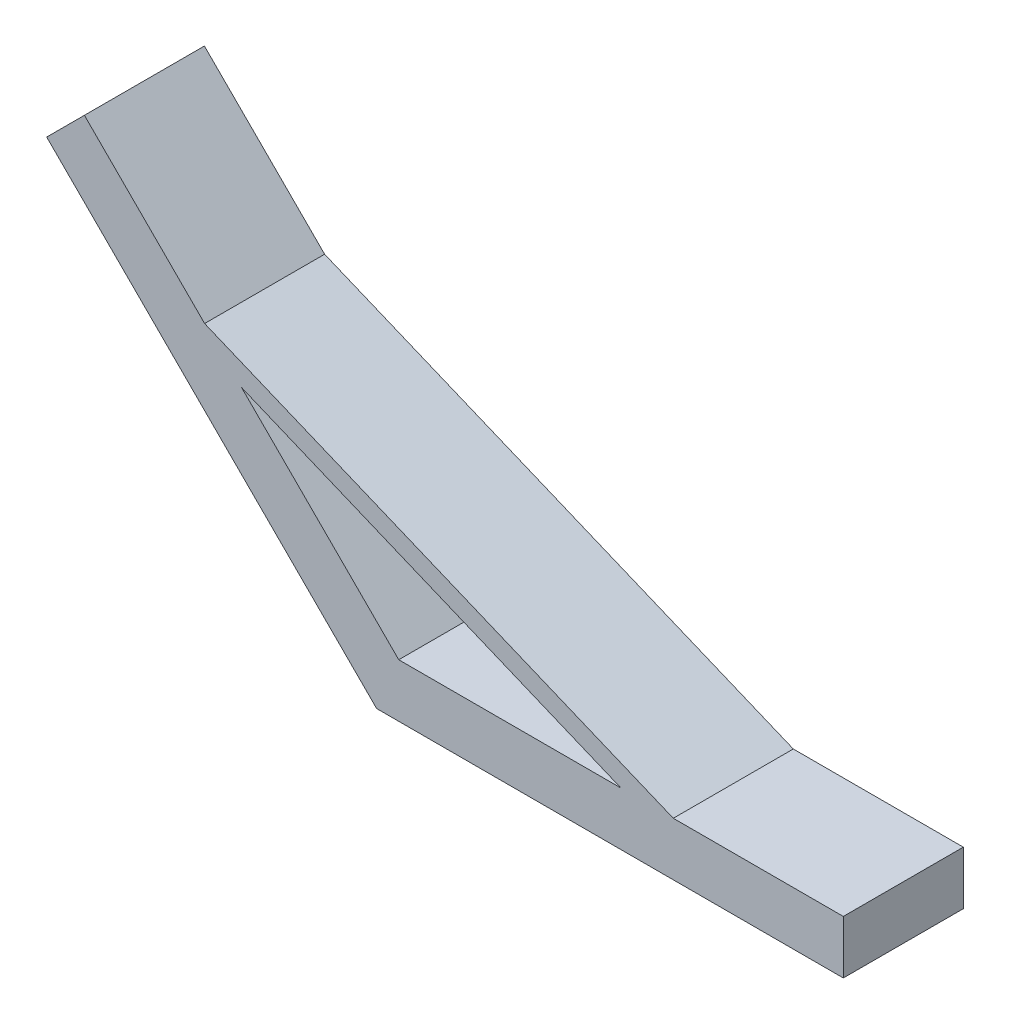
from build123d import *

# Parameters (mm, degrees)
EXTRUDE_1_DEPTH = 18


with BuildPart() as part:
    # 草图1 → 凸台-拉伸1 (new body)
    with BuildSketch(Plane.XY):
        Polygon((-49.497474683, 49.497474683), (0, 0), (70, 0), (70, 8), (44.496232039, 8), (-25.806733162, 37.120441661), (-43.840620434, 55.154328933), align=None)
        Polygon((3.313708499, 8), (-20.263455967, 31.577164466), (36.656854249, 8), align=None, mode=Mode.SUBTRACT)
    extrude(amount=EXTRUDE_1_DEPTH)


solid = part.part
